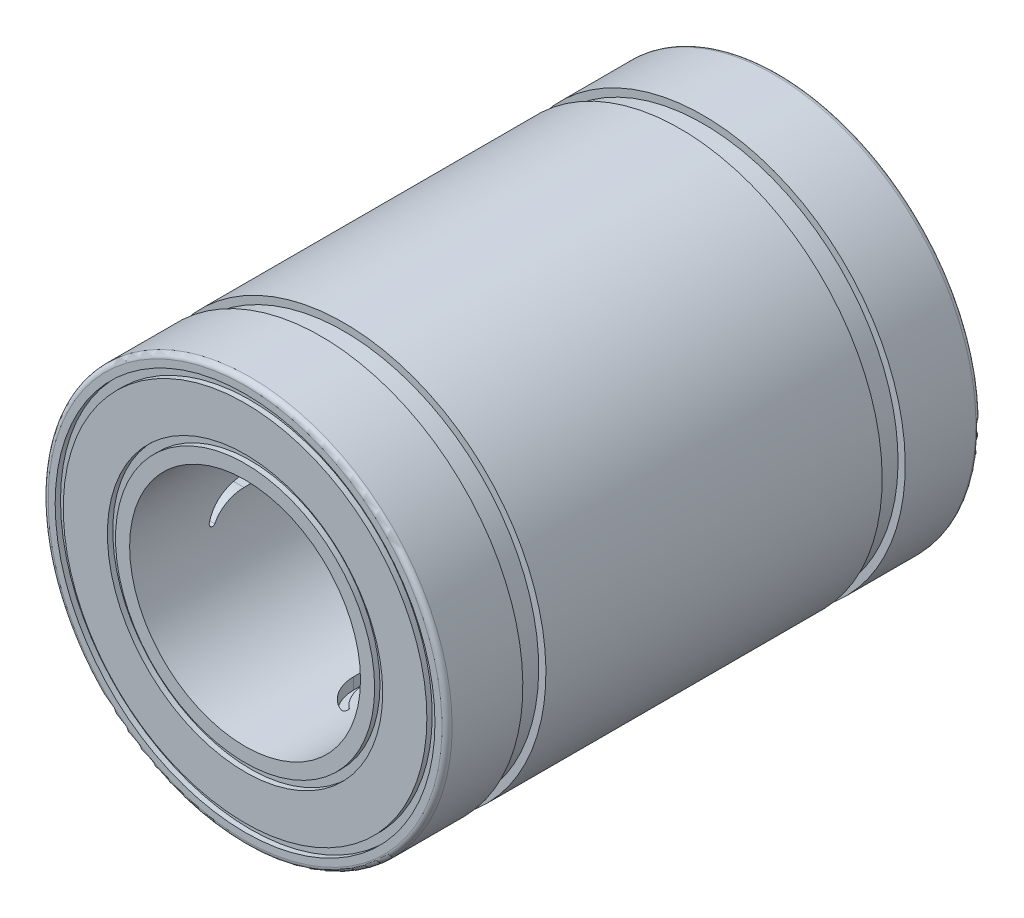
from build123d import *

# Parameters (mm, degrees)
SKETCH5_R               = 13.16
SKETCH5_R_2             = 12.6
SKETCH5_R_3             = 9.54
SKETCH5_R_4             = 8.98
CUT_EXTRUDE1_DEPTH      = 0.37
CUT_EXTRUDE3_REACH      = 29.097
CUT_EXTRUDE3_END_RADIUS = 8.8
CIRPATTERN3_COUNT       = 4
FILLET1_R               = 0.35


with BuildPart() as part:
    # Sketch4 → Revolve1 (revolve)
    with BuildSketch(Plane(origin=(0, 0, 0), x_dir=(0, 0, -1), z_dir=(1, 0, 0)), mode=Mode.PRIVATE) as revolve1_sk:
        Polygon((-18.5, 8), (-18.5, 14), (-13.25, 14), (-13.25, 13.5), (-11.65, 13.5), (-11.65, 14), (11.65, 14), (11.65, 13.5), (13.25, 13.5), (13.25, 14), (18.5, 14), (18.5, 8), align=None)
    revolve(revolve1_sk.sketch.rotate(Axis((0, 0, 18.5), (0, 0, -1)), 180), axis=Axis((0, 0, 18.5), (0, 0, -1)))

    # Sketch5 → Cut-Extrude1 (cut)
    # profile 1 of 2: a face of its own
    with BuildSketch(Plane.XY.offset(18.5)):
        Circle(SKETCH5_R)
        Circle(SKETCH5_R_2, mode=Mode.SUBTRACT)
    # profile 2 of 2: a face of its own
    with BuildSketch(Plane.XY.offset(18.5)):
        Circle(SKETCH5_R_3)
        Circle(SKETCH5_R_4, mode=Mode.SUBTRACT)
    cut_extrude1 = extrude(amount=-CUT_EXTRUDE1_DEPTH, mode=Mode.SUBTRACT)

    # Mirror1: Cut-Extrude1 across plane
    add(cut_extrude1.mirror(Plane.XY), mode=Mode.SUBTRACT)

    # Cut-Extrude3: up to this cylinder (the profile starts inside it)
    cut_extrude3_end = Plane(origin=(0, 0, 0), z_dir=(0, 0, 1)) * Cylinder(CUT_EXTRUDE3_END_RADIUS, 76.794, mode=Mode.PRIVATE)
    # Sketch7 → Cut-Extrude3 (cut, up to the surface)
    with BuildSketch(Plane(origin=(0, 0, 0), x_dir=(0, 0, -1), z_dir=(1, 0, 0)), mode=Mode.PRIVATE) as cut_extrude3_sk1:
        with BuildLine():
            Line((10.583333333, 0.41), (-10.583333333, 0.41))
            ThreePointArc((-10.583333333, 0.41), (-12.083272812, -0.045060718), (-13.077521352, -1.256823293))
            ThreePointArc((-13.077521352, -1.256823293), (-12.993660322, -1.506000528), (-12.735394354, -1.456800361))
            ThreePointArc((-12.735394354, -1.456800361), (-11.779907363, -0.68558119), (-10.583333333, -0.41))
            Line((-10.583333333, -0.41), (10.583333333, -0.41))
            ThreePointArc((10.583333333, -0.41), (11.779907363, -0.68558119), (12.735394354, -1.456800361))
            ThreePointArc((12.735394354, -1.456800361), (12.993660322, -1.506000528), (13.077521352, -1.256823293))
            ThreePointArc((13.077521352, -1.256823293), (12.083272812, -0.045060718), (10.583333333, 0.41))
        make_face()
    cut_extrude3_tool1 = extrude(cut_extrude3_sk1.sketch, amount=-CUT_EXTRUDE3_REACH, mode=Mode.PRIVATE) & cut_extrude3_end
    cut_extrude3 = cut_extrude3_tool1.solids().sort_by_distance((0, -0.07463, 0))[0]
    add(cut_extrude3, mode=Mode.SUBTRACT)

    # CirPattern3: Cut-Extrude3 ×4 about axis
    cirpattern3_axis = Axis((0, 0, 0), (0, 0, 1))
    for i in range(1, CIRPATTERN3_COUNT):
        add(cut_extrude3.rotate(cirpattern3_axis, i * 360 / CIRPATTERN3_COUNT), mode=Mode.SUBTRACT)

    # Fillet1
    fillet1_edges = [part.edges().sort_by_distance(p)[0] for p in [
        (0, 14, 18.5),
        (0, 14, -18.5),
    ]]
    fillet(fillet1_edges, radius=FILLET1_R)


solid = part.part
